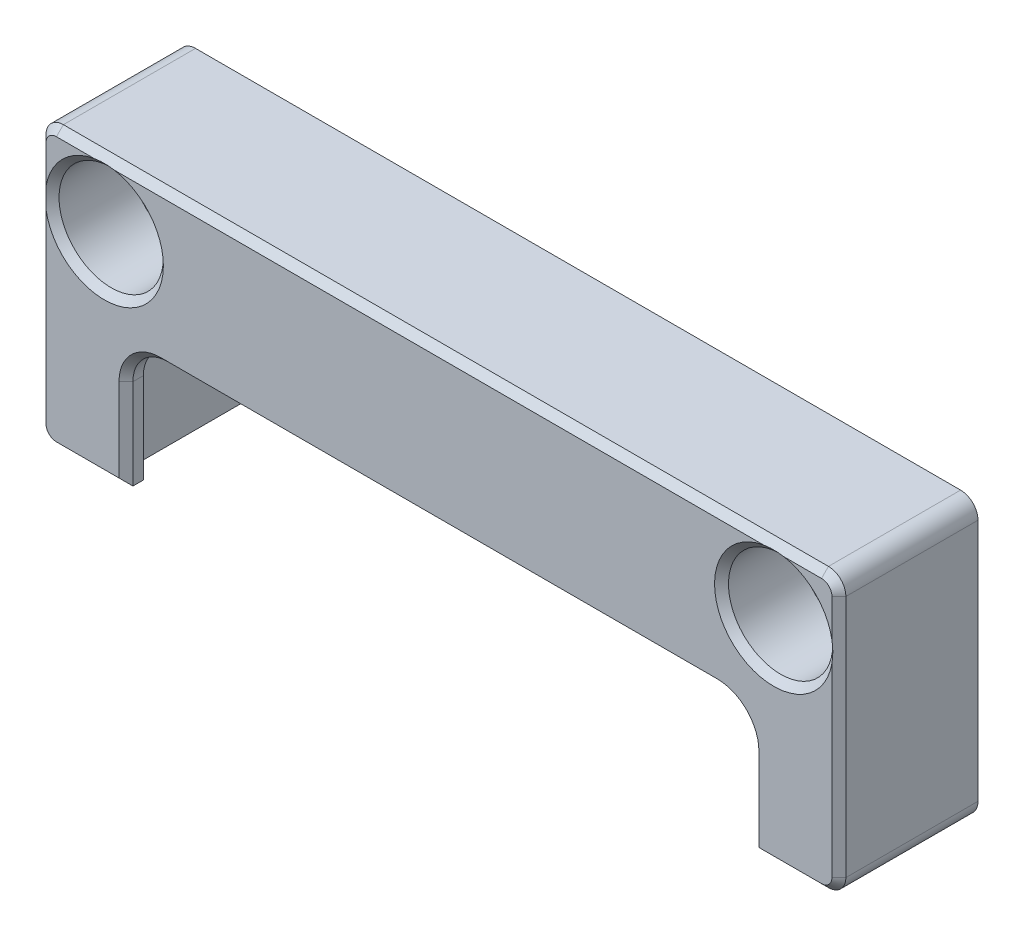
from build123d import *

# Parameters (mm, degrees)
BOSS_EXTRUDE1_DEPTH = 8
CUT_EXTRUDE1_REACH  = 51.356
SKETCH2_R           = 1.65
SKETCH3_R           = 3
CUT_EXTRUDE2_DEPTH  = 4.5
CUT_EXTRUDE3_DEPTH  = 7
FILLET1_R           = 1
CHAMFER2_SIZE       = 0.4


with BuildPart() as part:
    # Sketch1 → Boss-Extrude1 (new body)
    with BuildSketch(Plane.XY):
        with BuildLine():
            Line((0, 0), (0, 16))
            Line((0, 16), (46, 16))
            Line((46, 16), (46, 0))
            Line((46, 0), (41, 0))
            Line((41, 0), (41, 5.2))
            ThreePointArc((41, 5.2), (40.414213562, 6.614213562), (39, 7.2))
            Line((39, 7.2), (7, 7.2))
            ThreePointArc((7, 7.2), (5.585786438, 6.614213562), (5, 5.2))
            Line((5, 5.2), (5, 0))
            Line((5, 0), (0, 0))
        make_face()
    extrude(amount=BOSS_EXTRUDE1_DEPTH)

    # Sketch2 → Cut-Extrude1 (cut, up to next)
    with BuildSketch(Plane.XY.offset(8), mode=Mode.PRIVATE) as cut_extrude1_sk1:
        with Locations((3.75, 12.25)):
            Circle(SKETCH2_R)
    cut_extrude1_tool1 = extrude(cut_extrude1_sk1.sketch, amount=-CUT_EXTRUDE1_REACH, mode=Mode.PRIVATE) & part.part
    # Sketch2 → Cut-Extrude1 (cut, up to next)
    with BuildSketch(Plane.XY.offset(8), mode=Mode.PRIVATE) as cut_extrude1_sk2:
        with Locations((42.25, 12.25)):
            Circle(SKETCH2_R)
    cut_extrude1_tool2 = extrude(cut_extrude1_sk2.sketch, amount=-CUT_EXTRUDE1_REACH, mode=Mode.PRIVATE) & part.part
    add(cut_extrude1_tool1.solids().sort_by_distance((3.75, 12.25, 8))[0], mode=Mode.SUBTRACT)
    add(cut_extrude1_tool2.solids().sort_by_distance((42.25, 12.25, 8))[0], mode=Mode.SUBTRACT)

    # Sketch3 → Cut-Extrude2 (cut)
    with BuildSketch(Plane.XY.offset(8)):
        with Locations((3.75, 12.25)):
            Circle(SKETCH3_R)
        with Locations((42.25, 12.25)):
            Circle(SKETCH3_R)
    extrude(amount=-CUT_EXTRUDE2_DEPTH, mode=Mode.SUBTRACT)

    # Sketch4 → Cut-Extrude3 (cut)
    with BuildSketch(Plane(origin=(0, 0, 0), x_dir=(-1, 0, 0), z_dir=(0, 0, -1))):
        with BuildLine():
            Line((-4, 0), (-5, 0))
            Line((-5, 0), (-5, 5.2))
            ThreePointArc((-5, 5.2), (-5.585786438, 6.614213562), (-7, 7.2))
            Line((-7, 7.2), (-39, 7.2))
            ThreePointArc((-39, 7.2), (-40.414213592, 6.614213592), (-41, 5.2))
            Line((-41, 5.2), (-41, 0))
            Line((-41, 0), (-42, 0))
            Line((-42, 0), (-42, 5.200000101))
            ThreePointArc((-42, 5.200000101), (-41.121320373, 7.321320373), (-39.000000101, 8.2))
            Line((-39.000000101, 8.2), (-7, 8.2))
            ThreePointArc((-7, 8.2), (-4.878679656, 7.321320344), (-4, 5.2))
            Line((-4, 5.2), (-4, 0))
        make_face()
    extrude(amount=-CUT_EXTRUDE3_DEPTH, mode=Mode.SUBTRACT)

    # Fillet1
    fillet1_edges = [part.edges().sort_by_distance(p)[0] for p in [
        (0, 0, 4),
        (0, 16, 4),
        (46, 16, 4),
        (46, 0, 4),
    ]]
    fillet(fillet1_edges, radius=FILLET1_R)

    # Chamfer2
    # the kernel refuses this chamfer: 0.4 mm, written as the material it takes off along each edge
    with BuildSketch(Plane(origin=(6.028673195, 0, 8), x_dir=(0, 0.9996219169112966, 0.027495876610587326), z_dir=(-1, 0, 0)), Plane(origin=(45, 0, 8), x_dir=(0, 0.9996219169112966, 0.027495876610587378), z_dir=(-1, 0, 0))) as chamfer2_piece_1:
        Polygon((CHAMFER2_SIZE * 0.999621916911, CHAMFER2_SIZE * 0.0274958766106), (-CHAMFER2_SIZE * 0.0274958766106, CHAMFER2_SIZE * 0.999621916911), (0, 0), align=None)
    extrude(amount=5.028673195, mode=Mode.SUBTRACT)
    with BuildSketch(Plane(origin=(46, 15, 8), x_dir=(-0.9996219169112966, 0, 0.027495876610587656), z_dir=(0, -1, 0))) as chamfer2_piece_2:
        Polygon((CHAMFER2_SIZE * 0.999621916911, CHAMFER2_SIZE * 0.0274958766106), (-CHAMFER2_SIZE * 0.0274958766106, CHAMFER2_SIZE * 0.999621916911), (0, 0), align=None)
    extrude(amount=14, mode=Mode.SUBTRACT)
    with BuildSketch(Plane(origin=(1, 1, 8), x_dir=(-1, 0, 0), z_dir=(0, 1, 0))) as chamfer2_piece_3:
        Polygon((1, -CHAMFER2_SIZE), (1 - CHAMFER2_SIZE, 0), (1, 0), align=None)
    revolve(axis=Axis((1, 1, 8), (0, 0, 1)), revolution_arc=90, mode=Mode.SUBTRACT)
    with BuildSketch(Plane(origin=(45, 1, 8), x_dir=(1, 0, 0), z_dir=(0, 1, 0))) as chamfer2_piece_4:
        Polygon((1 - CHAMFER2_SIZE, 0), (1, CHAMFER2_SIZE), (1, 0), align=None)
    revolve(axis=Axis((45, 1, 8), (0, 0, -1)), revolution_arc=90, mode=Mode.SUBTRACT)
    with BuildSketch(Plane(origin=(45, 15, 8), x_dir=(0, 1, 0), z_dir=(-1, 0, 0))) as chamfer2_piece_5:
        Polygon((1 - CHAMFER2_SIZE, 0), (1, CHAMFER2_SIZE), (1, 0), align=None)
    revolve(axis=Axis((45, 15, 8), (0, 0, -1)), revolution_arc=90, mode=Mode.SUBTRACT)
    with BuildSketch(Plane(origin=(1, 15, 8), x_dir=(-1, 0, 0), z_dir=(0, -1, 0))) as chamfer2_piece_6:
        Polygon((1, CHAMFER2_SIZE), (1 - CHAMFER2_SIZE, 0), (1, 0), align=None)
    revolve(axis=Axis((1, 15, 8), (0, 0, -1)), revolution_arc=90, mode=Mode.SUBTRACT)
    with BuildSketch(Plane(origin=(7, 5.2, 8), x_dir=(0, 1, 0), z_dir=(1, 0, 0))) as chamfer2_piece_7:
        Polygon((2 + CHAMFER2_SIZE, 0), (2, -CHAMFER2_SIZE), (2, 0), align=None)
    revolve(axis=Axis((7, 5.2, 8), (0, 0, 1)), revolution_arc=90, mode=Mode.SUBTRACT)
    with BuildSketch(Plane(origin=(39, 7.2, 8), x_dir=(0, 0.9996219169112966, 0.027495876610587302), z_dir=(-1, 0, 0))) as chamfer2_piece_8:
        Polygon((CHAMFER2_SIZE * 0.999621916911, CHAMFER2_SIZE * 0.0274958766106), (-CHAMFER2_SIZE * 0.0274958766106, CHAMFER2_SIZE * 0.999621916911), (0, 0), align=None)
    extrude(amount=32, mode=Mode.SUBTRACT)
    with BuildSketch(Plane(origin=(39, 5.2, 8), x_dir=(1, 0, 0), z_dir=(0, -1, 0))) as chamfer2_piece_9:
        Polygon((2 + CHAMFER2_SIZE, 0), (2, -CHAMFER2_SIZE), (2, 0), align=None)
    revolve(axis=Axis((39, 5.2, 8), (0, 0, 1)), revolution_arc=90, mode=Mode.SUBTRACT)
    with BuildSketch(Plane(origin=(41, -1.028673195, 8), x_dir=(0.9996219169112966, 1.3659117145536696e-15, 0.027495876610587656), z_dir=(0, 1, 0)), Plane(origin=(5, 5.2, 8), x_dir=(-0.9996219169112966, 0, 0.027495876610587243), z_dir=(0, -1, 0))) as chamfer2_piece_10:
        Polygon((CHAMFER2_SIZE * 0.999621916911, CHAMFER2_SIZE * 0.0274958766106), (-CHAMFER2_SIZE * 0.0274958766106, CHAMFER2_SIZE * 0.999621916911), (0, 0), align=None)
    extrude(amount=6.228673195, mode=Mode.SUBTRACT)
    with BuildSketch(Plane(origin=(3.75, 12.25, 8), x_dir=(1, 0, 0), z_dir=(0, -1, 0))) as chamfer2_piece_11:
        Polygon((3 + CHAMFER2_SIZE, 0), (3, -CHAMFER2_SIZE), (3, 0), align=None)
    revolve(axis=Axis((3.75, 12.25, 8), (0, 0, 1)), mode=Mode.SUBTRACT)
    with BuildSketch(Plane(origin=(42.25, 12.25, 8), x_dir=(1, 0, 0), z_dir=(0, -1, 0))) as chamfer2_piece_12:
        Polygon((3 + CHAMFER2_SIZE, 0), (3, -CHAMFER2_SIZE), (3, 0), align=None)
    revolve(axis=Axis((42.25, 12.25, 8), (0, 0, 1)), mode=Mode.SUBTRACT)
    with BuildSketch(Plane(origin=(0, 1, 8), x_dir=(-0.027495876610586258, 0, -0.9996219169112966), z_dir=(0, 1, 0))) as chamfer2_piece_13:
        Polygon((CHAMFER2_SIZE * 0.999621916911, -CHAMFER2_SIZE * 0.0274958766106), (-CHAMFER2_SIZE * 0.0274958766106, -CHAMFER2_SIZE * 0.999621916911), (0, 0), align=None)
    extrude(amount=14, mode=Mode.SUBTRACT)
    with BuildSketch(Plane(origin=(1, 16, 8), x_dir=(0, -0.9996219169112966, 0.027495876610587302), z_dir=(1, 0, 0))) as chamfer2_piece_14:
        Polygon((CHAMFER2_SIZE * 0.999621916911, CHAMFER2_SIZE * 0.0274958766106), (-CHAMFER2_SIZE * 0.0274958766106, CHAMFER2_SIZE * 0.999621916911), (0, 0), align=None)
    extrude(amount=44, mode=Mode.SUBTRACT)


solid = part.part
